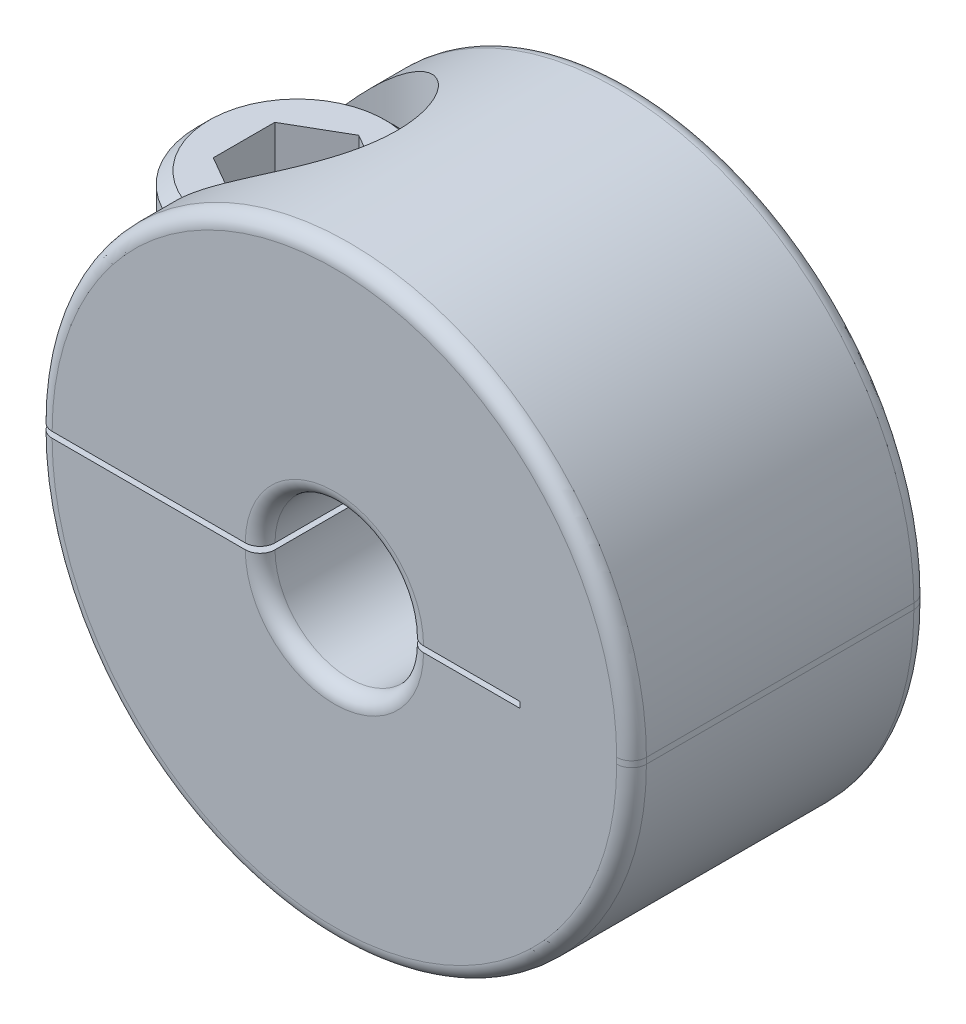
from build123d import *

# Parameters (mm, degrees)
EXTRUDE1_DEPTH     = 3.175
CUT_EXTRUDE2_DEPTH = 1.4224
FILLET1_R          = 0.3175
FILLET2_R          = 0.3175
CHAMFER2_SIZE      = 0.254


with BuildPart() as part:
    # Sketch1 → Extrude1 (new, symmetric)
    with BuildSketch(Plane.XY):
        with BuildLine():
            Line((-6.35, 0.0635), (-1.5875, 0.0635))
            ThreePointArc((-1.5875, 0.0635), (0, 1.651), (1.5875, 0.0635))
            Line((1.5875, 0.0635), (3.96875, 0.0635))
            Line((3.96875, 0.0635), (3.96875, -0.0635))
            Line((3.96875, -0.0635), (1.5875, -0.0635))
            ThreePointArc((1.5875, -0.0635), (0, -1.651), (-1.5875, -0.0635))
            Line((-1.5875, -0.0635), (-6.35, -0.0635))
            ThreePointArc((-6.35, -0.0635), (0, -6.4135), (6.35, -0.0635))
            Line((6.35, -0.0635), (6.35, 0.0635))
            ThreePointArc((6.35, 0.0635), (0, 6.4135), (-6.35, 0.0635))
        make_face()
    extrude(amount=EXTRUDE1_DEPTH, both=True)

    # Sketch4 → Cut-Revolve1 (revolve, cut)
    with BuildSketch(Plane.XY):
        Polygon((-3.96875, 6.4135), (-1.83515, 6.4135), (-1.83515, 1.4859), (-2.54635, 1.4859), (-2.54635, -6.4135), (-3.96875, -6.4135), align=None)
    revolve(axis=Axis((-3.96875, -6.4135, 0), (0, 1, 0)), mode=Mode.SUBTRACT)

    # Fillet1
    fillet1_edges = [part.edges().sort_by_distance(p)[0] for p in [
        (0, 1.651, -3.175),
        (0, 1.651, 3.175),
        (0, 6.4135, -3.175),
        (0, 6.4135, 3.175),
        (0, -6.4135, -3.175),
        (0, -6.4135, 3.175),
        (6.35, 0, -3.175),
        (6.35, 0, 3.175),
    ]]
    fillet(fillet1_edges, radius=FILLET1_R)

    # Fillet2
    fillet2_edges = [part.edges().sort_by_distance(p)[0] for p in [
        (0, -1.651, -3.175),
        (0, -1.651, 3.175),
    ]]
    fillet(fillet2_edges, radius=FILLET2_R)


with BuildPart() as body_2:
    # Sketch6 → Revolve1 (revolve)
    with BuildSketch(Plane.XY):
        Polygon((-3.96875, 4.3307), (-1.83515, 4.3307), (-1.83515, 1.4859), (-2.54635, 1.4859), (-2.54635, -4.2037), (-3.96875, -4.2037), align=None)
    revolve(axis=Axis((-3.96875, -4.2037, 0), (0, 1, 0)))

    # Sketch7 → Cut-Extrude2 (cut)
    with BuildSketch(Plane(origin=(0, 4.3307, 0), x_dir=(-1, 0, 0), z_dir=(0, 1, 0))):
        Polygon((3.96875, -1.313956837), (5.10667, -0.656978418), (5.10667, 0.656978418), (3.96875, 1.313956837), (2.83083, 0.656978418), (2.83083, -0.656978418), align=None)
    extrude(amount=-CUT_EXTRUDE2_DEPTH, mode=Mode.SUBTRACT)

    # Chamfer2
    chamfer2_edges = [body_2.edges().sort_by_distance(p)[0] for p in [
        (-6.10235, 4.3307, 0),
    ]]
    chamfer(chamfer2_edges, length=CHAMFER2_SIZE)


solid = Compound([part.part, body_2.part])
